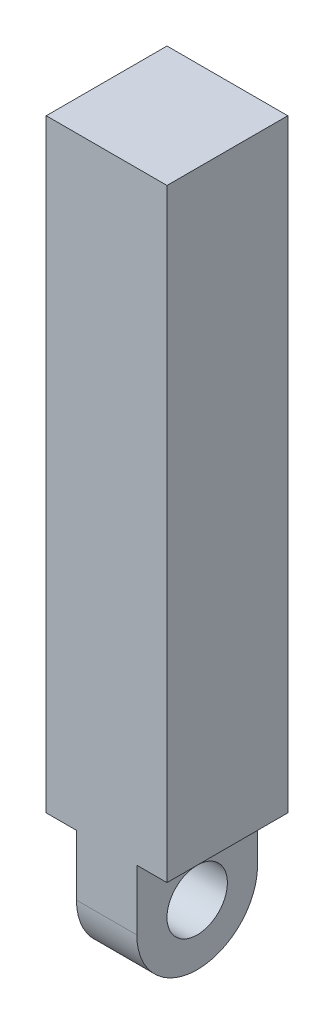
from build123d import *

# Parameters (mm, degrees)
SKETCH1_W           = 101.6
SKETCH1_H           = 101.6
BOSS_EXTRUDE1_DEPTH = 609.6
SKETCH2_W           = 25.4
SKETCH2_H           = 101.6
CUT_EXTRUDE1_DEPTH  = 621.093025279
FILLET1_R           = 50.8
SKETCH3_R           = 25.4
CUT_EXTRUDE2_DEPTH  = 617.440783855


with BuildPart() as part:
    # Sketch1 → Boss-Extrude1 (new body)
    with BuildSketch(Plane(origin=(0, 0, 0), x_dir=(1, 0, 0), z_dir=(0, 1, 0))):
        Rectangle(SKETCH1_W, SKETCH1_H)
    extrude(amount=BOSS_EXTRUDE1_DEPTH)

    # Sketch2 → Cut-Extrude1 (cut, through all)
    with BuildSketch(Plane.XY.offset(50.8)):
        with Locations((-38.1, 50.8)):
            Rectangle(SKETCH2_W, SKETCH2_H)
        with Locations((38.1, 50.8)):
            Rectangle(SKETCH2_W, SKETCH2_H)
    extrude(amount=-CUT_EXTRUDE1_DEPTH, mode=Mode.SUBTRACT)

    # Fillet1
    fillet1_edges = [part.edges().sort_by_distance(p)[0] for p in [
        (0, 0, -50.8),
        (0, 0, 50.8),
    ]]
    fillet(fillet1_edges, radius=FILLET1_R - 0.0001)  # a hair under: the kernel refuses the full size

    # Sketch3 → Cut-Extrude2 (cut, through all)
    with BuildSketch(Plane.ZY.offset(25.4)):
        with Locations((0, 50.8)):
            Circle(SKETCH3_R)
    extrude(amount=-CUT_EXTRUDE2_DEPTH, mode=Mode.SUBTRACT)


solid = part.part
